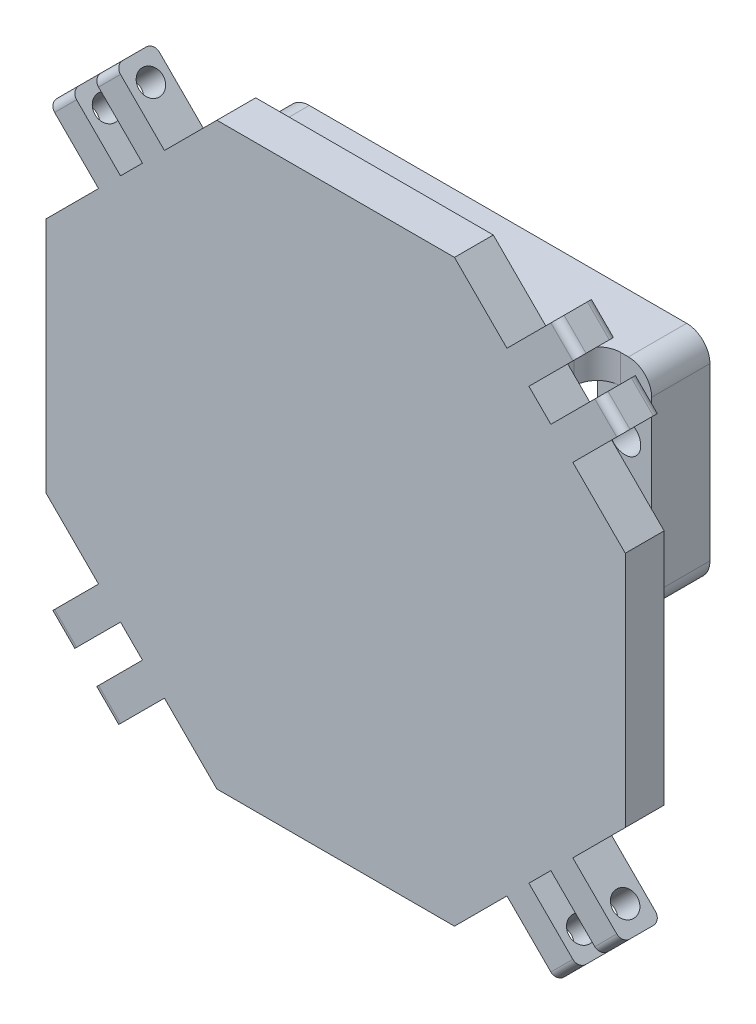
from build123d import *

# Parameters (mm, degrees)
SKETCH2_W            = 54.6
SKETCH2_H            = 28
SKETCH2_R            = 2.04
SKETCH2_W_2          = 40.6
SKETCH2_H_2          = 20.5
BOSS_EXTRUDE1_DEPTH  = 7.5
SKETCH3_W            = 40.6
SKETCH3_H            = 3.75
BOSS_EXTRUDE2_DEPTH  = 18.4
SKETCH7_W            = 74.600133011
SKETCH7_H            = 74.600133011
BOSS_EXTRUDE4_DEPTH  = 5
CUT_EXTRUDE2_DEPTH   = 5
SKETCH9_R            = 1.55
CUT_EXTRUDE3_DEPTH   = 16
FILLET3_R            = 1
FILLET3_OF_MIRROR4_R = 1
FILLET4_R            = 3


# Read off the part's stored shape, not the designer's step: Mirror5
with BuildPart() as part:
    # Sketch2 → Boss-Extrude1 (new body)
    with BuildSketch(Plane.XY):
        Rectangle(SKETCH2_W, SKETCH2_H)
        with Locations((23.85, 4.9)):
            Circle(SKETCH2_R, mode=Mode.SUBTRACT)
        with Locations(Location((23.85, -4.9, 0), (0, 0, 180))):
            Circle(SKETCH2_R, mode=Mode.SUBTRACT)
        with Locations((-23.85, -4.9)):
            Circle(SKETCH2_R, mode=Mode.SUBTRACT)
        with Locations(Location((-23.85, 4.9, 0), (0, 0, 180))):
            Circle(SKETCH2_R, mode=Mode.SUBTRACT)
        Rectangle(SKETCH2_W_2, SKETCH2_H_2, mode=Mode.SUBTRACT)
    extrude(amount=BOSS_EXTRUDE1_DEPTH)

    # Sketch3 → Boss-Extrude2 (add)
    with BuildSketch(Plane.XY.offset(7.5)):
        with Locations((0, 12.125)):
            Rectangle(SKETCH3_W, SKETCH3_H)
        with Locations((0, -12.125)):
            Rectangle(SKETCH3_W, SKETCH3_H)
    extrude(amount=BOSS_EXTRUDE2_DEPTH)

    # Sketch7 → Boss-Extrude4 (add)
    with BuildSketch(Plane.XY.offset(25.9)):
        with Locations((10.000066505, -7.842e-05)):
            Rectangle(SKETCH7_W, SKETCH7_H)
    extrude(amount=BOSS_EXTRUDE4_DEPTH)

    # Sketch8 → Cut-Extrude2 (cut)
    with BuildSketch(Plane.XY.offset(30.9)):
        Polygon((-27.3, 15.299988086), (-20.542640687, 22.057347399), (-26.906601718, 28.421308429), (-24.078174593, 31.249735554), (-17.714213562, 24.885774524), (-14.885786438, 27.714201648), (-21.249747468, 34.078162679), (-18.421320344, 36.906589804), (-12.057359313, 30.542628773), (-5.3, 37.299988086), (-27.3, 37.299988086), align=None)
    cut_extrude2 = extrude(amount=-CUT_EXTRUDE2_DEPTH, mode=Mode.SUBTRACT)

    # Sketch9 → Cut-Extrude3 (cut)
    with BuildSketch(Plane(origin=(0.757353356, 0.757353356, 0), x_dir=(0, 0, 1), z_dir=(-0.7071067811865474, -0.7071067811865477, 0))):
        with Locations(Location((28.4, 36.122740454, 0), (0, 0, 270))):
            Circle(SKETCH9_R)
    cut_extrude3 = extrude(amount=-CUT_EXTRUDE3_DEPTH, mode=Mode.SUBTRACT)

    # Fillet3
    fillet3_edges = [part.edges().sort_by_distance(p)[0] for p in [
        (-25.492388155, 29.835521992, 30.9),
        (-19.835533906, 35.492376241, 30.9),
        (-19.835533906, 35.492376241, 25.9),
        (-25.492388155, 29.835521992, 25.9),
    ]]
    fillet(fillet3_edges, radius=FILLET3_R)

    # Mirror4: Cut-Extrude2, Cut-Extrude3 across plane
    add(cut_extrude2.mirror(Plane.ZY.offset(-10.000066506)), mode=Mode.SUBTRACT)
    add(cut_extrude3.mirror(Plane.ZY.offset(-10.000066506)), mode=Mode.SUBTRACT)

    # Fillet3 of Mirror4
    fillet3_of_mirror4_edges = [part.edges().sort_by_distance(p)[0] for p in [
        (45.492521167, 29.835521992, 30.9),
        (39.835666917, 35.492376241, 30.9),
        (39.835666917, 35.492376241, 25.9),
        (45.492521167, 29.835521992, 25.9),
    ]]
    fillet(fillet3_of_mirror4_edges, radius=FILLET3_OF_MIRROR4_R)

    # Mirror5
    split(bisect_by=Plane.ZX.offset(-7.842e-05), keep=Keep.TOP)

    # Mirror5 2: part across plane


with BuildPart() as part_1:
    add(part.part)
    add(part.part.mirror(Plane.ZX.offset(-7.842e-05)))

    # Fillet4
    fillet4_edges = [part_1.edges().sort_by_distance(p)[0] for p in [
        (-20.3, 12.125, 7.5),
        (20.3, 12.125, 7.5),
        (0, 14, 25.9),
        (-20.3, 12.125, 25.9),
        (20.3, 12.125, 25.9),
        (-20.3, -12.125156839, 7.5),
        (20.3, -12.125156839, 7.5),
        (-20.3, -12.125156839, 25.9),
        (0, -14.000156839, 25.9),
        (20.3, -12.125156839, 25.9),
        (-27.3, -14.000156839, 3.75),
        (-27.3, 14, 3.75),
        (27.3, 14, 3.75),
        (27.3, -14.000156839, 3.75),
    ]]
    fillet(fillet4_edges, radius=FILLET4_R)


solid = part_1.part
